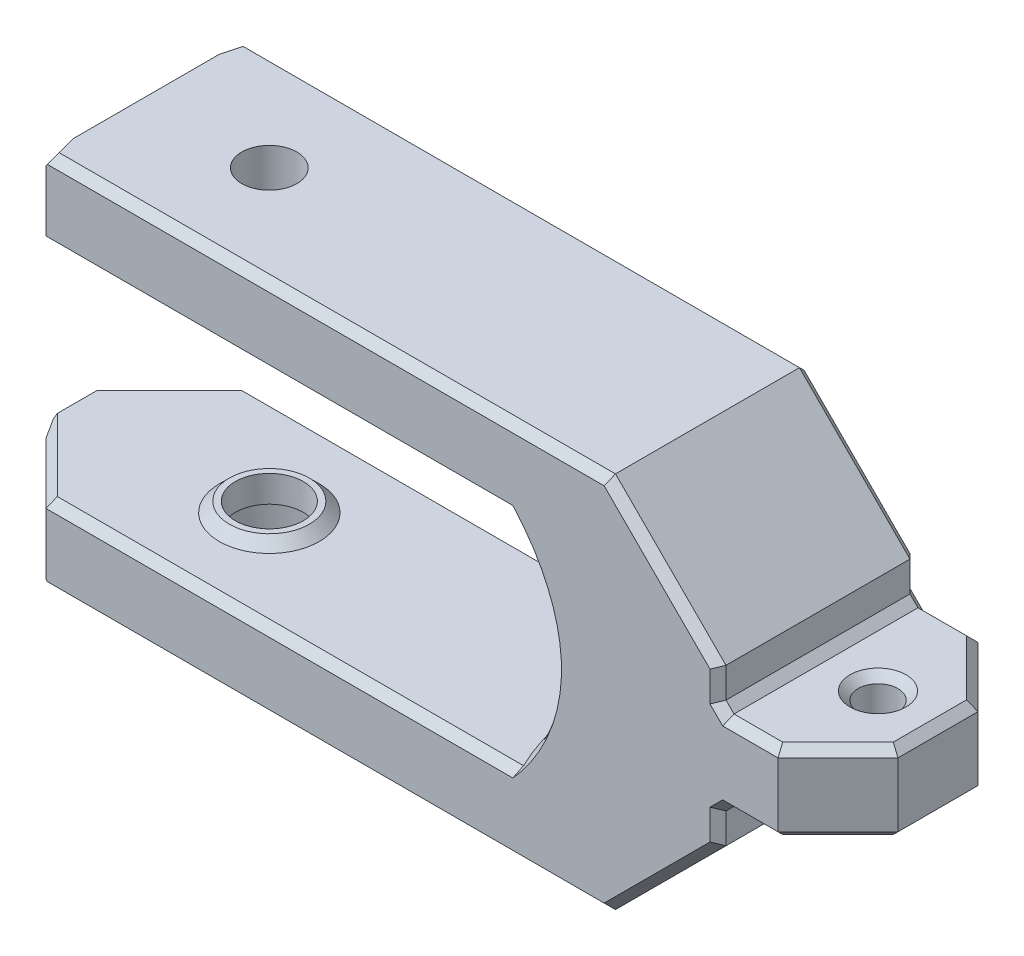
from build123d import *

# Parameters (mm, degrees)
BOSS_EXTRUDE1_DEPTH      = 5
BOSS_EXTRUDE1_DEPTH_BACK = 5
CUT_EXTRUDE1_DEPTH       = 34.669323141
CUT_EXTRUDE1_DEPTH_BACK  = 34.669323141
SKETCH2_R                = 1.375
CUT_EXTRUDE2_REACH       = 35.669
SKETCH3_R                = 1.7
SKETCH4_R                = 3.1
CUT_EXTRUDE3_DEPTH       = 3.1
CHAMFER1_SIZE            = 3.43398
CUT_EXTRUDE4_START       = -5
CUT_EXTRUDE4_DEPTH       = 10
CHAMFER2_SIZE            = 0.4
CHAMFER3_SIZE            = 0.4
CHAMFER3_EDGE_2_SIZE     = 0.4
CHAMFER3_EDGE_2_SIZE2    = 1.092820323
CHAMFER3_EDGE_3_SIZE     = 0.4
CHAMFER3_EDGE_3_SIZE2    = 1.092820323
CHAMFER3_EDGE_4_SIZE     = 0.4
CHAMFER3_EDGE_5_SIZE     = 0.4
CHAMFER3_EDGE_6_SIZE     = 0.4
CHAMFER3_EDGE_7_SIZE     = 0.4
CHAMFER3_EDGE_7_SIZE2    = 1.092820323
CHAMFER3_EDGE_8_SIZE     = 0.4
CHAMFER3_EDGE_8_SIZE2    = 1.092820323
SKETCH9_W                = 10
SKETCH9_H                = 4
BOSS_EXTRUDE3_DEPTH      = 6
CUT_EXTRUDE5_REACH       = 37.687
SKETCH10_R               = 1
CHAMFER4_SIZE            = 0.4
CHAMFER5_SIZE            = 3
CHAMFER6_SIZE            = 0.4
MOVE_FACE1_OUTLINE_R     = 1.7
MOVE_FACE1_OUTLINE_R_2   = 1.375
MOVE_FACE1_DEPTH         = 0.5


# Read off the part's stored shape, not the designer's step: Move Face1
with BuildPart() as part:
    # Sketch1 → Boss-Extrude1 (new, two sides: drawn at the far end of the back side and taken through both)
    with BuildSketch(Plane.XY.offset(-BOSS_EXTRUDE1_DEPTH_BACK)):
        Polygon((27.433981132, -1.092317068), (21.907682932, 4.433981132), (-6.166018868, 4.433981132), (-9.6, 1), (-9.6, 0.5), (11.1, 0.5), (11.1, -10.5), (-9.6, -10.5), (-9.6, -11), (-6.166018868, -14.433981132), (21.907682932, -14.433981132), (27.433981132, -8.907682932), align=None)
    extrude(amount=BOSS_EXTRUDE1_DEPTH + BOSS_EXTRUDE1_DEPTH_BACK)

    # Sketch2 → Cut-Extrude1 (cut, two sides: drawn at the far end of the back side and taken through both)
    with BuildSketch(Plane.XZ.offset(14.433981132).offset(-CUT_EXTRUDE1_DEPTH_BACK)):
        Circle(SKETCH2_R)
    extrude(amount=CUT_EXTRUDE1_DEPTH + CUT_EXTRUDE1_DEPTH_BACK, mode=Mode.SUBTRACT)

    # Sketch3 → Cut-Extrude2 (cut, up to next)
    with BuildSketch(Plane.XZ.offset(14.433981132), mode=Mode.PRIVATE) as cut_extrude2_sk1:
        Circle(SKETCH3_R)
    cut_extrude2_tool1 = extrude(cut_extrude2_sk1.sketch, amount=-CUT_EXTRUDE2_REACH, mode=Mode.PRIVATE) & part.part
    add(cut_extrude2_tool1.solids().sort_by_distance((0, -14.433981, 0))[0], mode=Mode.SUBTRACT)

    # Sketch4 → Cut-Extrude3 (cut)
    with BuildSketch(Plane.XZ.offset(14.433981132)):
        Circle(SKETCH4_R)
    extrude(amount=-CUT_EXTRUDE3_DEPTH, mode=Mode.SUBTRACT)

    # Sketch5 → Revolve1 (revolve)
    with BuildSketch(Plane.XY, mode=Mode.PRIVATE) as revolve1_sk:
        Polygon((-1.7, -10.5), (-2.5, -10.5), (-2, -10), (-1.7, -10), align=None)
    revolve1 = revolve(revolve1_sk.sketch.rotate(Axis((0, 4.433981132, 0), (0, -1, 0)), 180), axis=Axis((0, 4.433981132, 0), (0, -1, 0)))

    # Mirror1: Revolve1 across plane
    add(revolve1.mirror(Plane(origin=(0, -5, 0), x_dir=(0, 0, 1), z_dir=(0, -1, 0))))

    # Chamfer1
    chamfer1_edges = [part.edges().sort_by_distance(p)[0] for p in [
        (-9.6, 0.75, 5),
        (-9.6, 0.75, -5),
        (-9.6, -10.75, -5),
        (-9.6, -10.75, 5),
    ]]
    chamfer(chamfer1_edges, length=CHAMFER1_SIZE)

    # Sketch7 → Cut-Extrude4 (cut)
    with BuildSketch(Plane.XY.offset(CUT_EXTRUDE4_START)):
        with BuildLine():
            Line((11.1, 0.5), (11.1, -10.5))
            Line((11.1, -10.5), (16.230873726, -10.5))
            ThreePointArc((16.230873726, -10.5), (18, -5), (16.230873726, 0.5))
            Line((16.230873726, 0.5), (11.1, 0.5))
        make_face()
    extrude(amount=CUT_EXTRUDE4_DEPTH, mode=Mode.SUBTRACT)

    # Sketch7<2> → Cut-Revolve3 (revolve, cut)
    with BuildSketch(Plane.XY):
        with BuildLine():
            Line((11.1, 0.5), (11.1, -10.5))
            Line((11.1, -10.5), (16.230873726, -10.5))
            ThreePointArc((16.230873726, -10.5), (18, -5), (16.230873726, 0.5))
            Line((16.230873726, 0.5), (11.1, 0.5))
        make_face()
    revolve(axis=Axis((26.566018868, 5.861349866, 0), (0, -1, 0)), mode=Mode.SUBTRACT)

    # Chamfer2
    chamfer2_edges = [part.edges().sort_by_distance(p)[0] for p in [
        (5.677410985, -10.5, -5),
        (7.870832032, -14.433981132, -5),
        (24.670832032, -11.670832032, -5),
        (5.677410985, -10.5, 5),
        (7.870832032, -14.433981132, 5),
        (24.670832032, -11.670832032, 5),
        (24.670832032, 1.670832032, 5),
        (24.670832032, 1.670832032, -5),
        (7.870832032, 4.433981132, 5),
        (7.870832032, 4.433981132, -5),
        (5.677410985, 0.5, 5),
        (5.677410985, 0.5, -5),
    ]]
    chamfer(chamfer2_edges, length=CHAMFER2_SIZE)

    # Chamfer3
    chamfer3_edges = [part.edges().sort_by_distance(p)[0] for p in [
        (-8.08301, 0.5, 3.08301),
    ]]
    chamfer(chamfer3_edges, length=CHAMFER3_SIZE)

    # Chamfer3 edge 2
    chamfer3_edge_2_edges = [part.edges().sort_by_distance(p)[0] for p in [
        (-7.983009717, 2.616990283, 3.183010283),
    ]]
    chamfer3_edge_2_side = [part.faces().sort_by_distance(p)[0] for p in [
        (-7.458377293, 1.830066089, 3.707642707),
    ]]
    chamfer(chamfer3_edge_2_edges, length=CHAMFER3_EDGE_2_SIZE, length2=CHAMFER3_EDGE_2_SIZE2, reference=chamfer3_edge_2_side[0])

    # Chamfer3 edge 3
    chamfer3_edge_3_edges = [part.edges().sort_by_distance(p)[0] for p in [
        (-7.983009717, 2.616990283, -3.183010283),
    ]]
    chamfer3_edge_3_side = [part.faces().sort_by_distance(p)[0] for p in [
        (-7.458377293, 1.830066089, -3.707642707),
    ]]
    chamfer(chamfer3_edge_3_edges, length=CHAMFER3_EDGE_3_SIZE, length2=CHAMFER3_EDGE_3_SIZE2, reference=chamfer3_edge_3_side[0])

    # Chamfer3 edge 4
    chamfer3_edge_4_edges = [part.edges().sort_by_distance(p)[0] for p in [
        (-8.08301, 0.5, -3.08301),
    ]]
    chamfer(chamfer3_edge_4_edges, length=CHAMFER3_EDGE_4_SIZE)

    # Chamfer3 edge 5
    chamfer3_edge_5_edges = [part.edges().sort_by_distance(p)[0] for p in [
        (-8.08301, -10.5, 3.08301),
    ]]
    chamfer(chamfer3_edge_5_edges, length=CHAMFER3_EDGE_5_SIZE)

    # Chamfer3 edge 6
    chamfer3_edge_6_edges = [part.edges().sort_by_distance(p)[0] for p in [
        (-8.08301, -10.5, -3.08301),
    ]]
    chamfer(chamfer3_edge_6_edges, length=CHAMFER3_EDGE_6_SIZE)

    # Chamfer3 edge 7
    chamfer3_edge_7_edges = [part.edges().sort_by_distance(p)[0] for p in [
        (-7.983009717, -12.616990283, 3.183010283),
    ]]
    chamfer3_edge_7_side = [part.faces().sort_by_distance(p)[0] for p in [
        (-7.458377293, -11.830066089, 3.707642707),
    ]]
    chamfer(chamfer3_edge_7_edges, length=CHAMFER3_EDGE_7_SIZE, length2=CHAMFER3_EDGE_7_SIZE2, reference=chamfer3_edge_7_side[0])

    # Chamfer3 edge 8
    chamfer3_edge_8_edges = [part.edges().sort_by_distance(p)[0] for p in [
        (-7.983009717, -12.616990283, -3.183010283),
    ]]
    chamfer3_edge_8_side = [part.faces().sort_by_distance(p)[0] for p in [
        (-7.458377293, -11.830066089, -3.707642707),
    ]]
    chamfer(chamfer3_edge_8_edges, length=CHAMFER3_EDGE_8_SIZE, length2=CHAMFER3_EDGE_8_SIZE2, reference=chamfer3_edge_8_side[0])

    # Sketch9 → Boss-Extrude3 (add)
    with BuildSketch(Plane(origin=(27.433981132, 0, 0), x_dir=(0, 0, -1), z_dir=(1, 0, 0))):
        with Locations((0, -5)):
            Rectangle(SKETCH9_W, SKETCH9_H)
    extrude(amount=BOSS_EXTRUDE3_DEPTH)

    # Sketch10 → Cut-Extrude5 (cut, up to next)
    with BuildSketch(Plane(origin=(0, -3, 0), x_dir=(1, 0, 0), z_dir=(0, 1, 0)), mode=Mode.PRIVATE) as cut_extrude5_sk1:
        with Locations(Location((30.433981132, 0, 0), (0, 0, 270))):
            Circle(SKETCH10_R)
    cut_extrude5_tool1 = extrude(cut_extrude5_sk1.sketch, amount=-CUT_EXTRUDE5_REACH, mode=Mode.PRIVATE) & part.part
    add(cut_extrude5_tool1.solids().sort_by_distance((30.433981, -3, 0))[0], mode=Mode.SUBTRACT)

    # Chamfer4
    chamfer4_edges = [part.edges().sort_by_distance(p)[0] for p in [
        (27.433981132, -3, 0),
        (27.433981132, -7, 0),
    ]]
    chamfer(chamfer4_edges, length=CHAMFER4_SIZE)

    # Chamfer5
    chamfer5_edges = [part.edges().sort_by_distance(p)[0] for p in [
        (33.433981132, -5, -5),
        (33.433981132, -5, 5),
    ]]
    chamfer(chamfer5_edges, length=CHAMFER5_SIZE)

    # Chamfer6
    chamfer6_edges = [part.edges().sort_by_distance(p)[0] for p in [
        (30.433981132, -3, -1),
        (30.433981132, -7, -1),
        (27.433981132, -7.870998754, 5),
        (27.633981132, -7.2, 5),
        (27.633981132, -7.2, -5),
        (29.133981132, -7, 5),
        (31.933981132, -7, 3.5),
        (33.433981132, -7, 0),
        (31.933981132, -7, -3.5),
        (27.433981132, -7.870998754, -5),
        (29.133981132, -7, -5),
        (27.433981132, -2.129001246, 5),
        (27.633981132, -2.8, -5),
        (27.633981132, -2.8, 5),
        (29.133981132, -3, 5),
        (31.933981132, -3, 3.5),
        (33.433981132, -3, 0),
        (31.933981132, -3, -3.5),
        (29.133981132, -3, -5),
        (27.433981132, -2.129001246, -5),
    ]]
    chamfer(chamfer6_edges, length=CHAMFER6_SIZE)

    # Move Face1 outline → Move Face1 (add)
    with BuildSketch(Plane(origin=(0, 0, 0), x_dir=(1, 0, 0), z_dir=(0, 1, 0))):
        Circle(MOVE_FACE1_OUTLINE_R)
        Circle(MOVE_FACE1_OUTLINE_R_2, mode=Mode.SUBTRACT)
    extrude(amount=MOVE_FACE1_DEPTH)


solid = part.part
